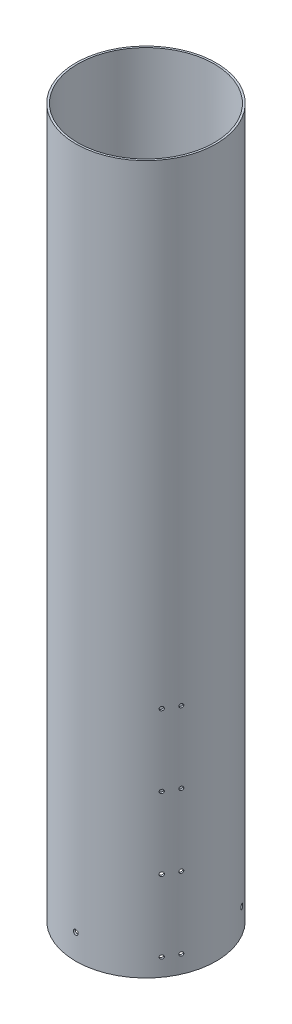
from build123d import *
from OCP.BRepAlgoAPI import BRepAlgoAPI_Cut
from OCP.TopTools import TopTools_ListOfShape

# Parameters (mm, degrees)
SKETCH1_W                          = 78.36
SKETCH1_H                          = 1150
HOLE1_D                            = 152.4
SKETCH4_W                          = 1.62
SKETCH4_H                          = 158.897170611
M3_CLEARANCE_HOLE2_OUTLINE_W       = 1.62
M3_CLEARANCE_HOLE2_OUTLINE_H       = 2.177212512
M3_CLEARANCE_HOLE2_OUTLINE_H_2     = 2.177231722
SKETCH8_W                          = 1.62
SKETCH8_H                          = 158.897170611
F_5_5_5_5_DIAMETER_HOLE1_D         = 5.5
F_5_5_5_5_DIAMETER_HOLE1_DEPTH     = 2.209638872
F_5_5_5_5_DIAMETER_HOLE2_D         = 5.5
F_5_5_5_5_DIAMETER_HOLE2_DEPTH     = 30.891389512
F_5_5_5_5_DIAMETER_HOLE3_D         = 5.5
F_5_5_5_5_DIAMETER_HOLE3_DEPTH     = 30.891389512
HOLE2_REACH                        = 1167.167
HOLE2_BORE_R                       = 2.102512626
F_4_5_4_5_DIAMETER_HOLE1_REACH     = 1167.169
F_4_5_4_5_DIAMETER_HOLE1_BORE_R    = 2.25
HOLE3_REACH                        = 1167.167
HOLE3_BORE_R                       = 2.102512626
F_4_5_4_5_DIAMETER_HOLE2_REACH     = 1167.169
F_4_5_4_5_DIAMETER_HOLE2_BORE_R    = 2.25
HOLE4_REACH                        = 1165.242
HOLE4_BORE_R                       = 2.102512626
F_4_5_START                        = -79
F_4_5_4_5_DIAMETER_HOLE3_OUTLINE_R = 2.25
F_4_5_4_5_DIAMETER_HOLE3_DEPTH     = 4
CUT_EXTRUDE1_START                 = -360
SKETCH28_R                         = 78.36
CUT_EXTRUDE1_DEPTH                 = 360


with BuildPart() as part:
    # Sketch1 → Revolve1 (revolve)
    with BuildSketch(Plane(origin=(0, 0, 0), x_dir=(-1, 0, 0), z_dir=(0, 0, -1)), mode=Mode.PRIVATE) as revolve1_sk:
        with Locations((-39.18, 575)):
            Rectangle(SKETCH1_W, SKETCH1_H)
    revolve(revolve1_sk.sketch.rotate(Axis((0, 0, 0), (0, 1, 0)), 270), axis=Axis((0, 0, 0), (0, 1, 0)))

    # Hole1 (through all)
    with Locations(Plane(origin=(0, 0, 0), x_dir=(-1, 0, 0), z_dir=(0, -1, 0))):
        with Locations((0, 0)):
            Hole(HOLE1_D / 2)

    # Sketch4 → M3 Clearance Hole1 (revolve, cut)
    with BuildSketch(Plane(origin=(-67.861735685, 1140, -39.179991365), x_dir=(-0.5000000000000017, 0, 0.8660254037844377), z_dir=(0, 1, 0))):
        with Locations((0.81, 79.448585306)):
            Rectangle(SKETCH4_W, SKETCH4_H)
    revolve(axis=Axis((-73.360996999, 1140, -42.354991365), (0.8660254037844377, 0, 0.5000000000000017)), mode=Mode.SUBTRACT)


with BuildPart() as m3_clearance_hole2_tool:
    # M3 Clearance Hole2: read off the stored shape, not the designer's step
    # M3 Clearance Hole2 outline → M3 Clearance Hole2 (revolve)
    with BuildSketch(Plane.XZ.offset(-1140)):
        with Locations((0.81, -77.271376475)):
            Rectangle(M3_CLEARANCE_HOLE2_OUTLINE_W, M3_CLEARANCE_HOLE2_OUTLINE_H)
        with Locations((0.81, 77.271384187)):
            Rectangle(M3_CLEARANCE_HOLE2_OUTLINE_W, M3_CLEARANCE_HOLE2_OUTLINE_H_2)
    revolve(axis=Axis((0, 1140, 0), (0, 0, 1)))


with BuildPart() as part_1:
    add(part.part)

    # M3 Clearance Hole2: cut by m3_clearance_hole2_tool, with a tolerance
    m3_clearance_hole2_stock = TopTools_ListOfShape()
    m3_clearance_hole2_stock.Append(part_1.part.wrapped)
    m3_clearance_hole2_tools = TopTools_ListOfShape()
    m3_clearance_hole2_tools.Append(m3_clearance_hole2_tool.part.wrapped)
    m3_clearance_hole2_cut = BRepAlgoAPI_Cut()
    m3_clearance_hole2_cut.SetArguments(m3_clearance_hole2_stock)
    m3_clearance_hole2_cut.SetTools(m3_clearance_hole2_tools)
    m3_clearance_hole2_cut.SetFuzzyValue(0.00001)
    m3_clearance_hole2_cut.Build()
    add(Compound.cast(m3_clearance_hole2_cut.Shape()).solids(), mode=Mode.REPLACE)

    # Sketch8 → M3 Clearance Hole3 (revolve, cut)
    with BuildSketch(Plane(origin=(67.861735685, 1140, -39.179991365), x_dir=(-0.5000000000000004, 0, -0.8660254037844384), z_dir=(0, 1, 0))):
        with Locations((0.81, 79.448585306)):
            Rectangle(SKETCH8_W, SKETCH8_H)
    revolve(axis=Axis((73.360996999, 1140, -42.354991365), (-0.8660254037844384, 0, 0.5000000000000004)), mode=Mode.SUBTRACT)

    # Ø5.5 (5.5) Diameter Hole1
    with Locations(Plane(origin=(0, 0, 76.150361128), x_dir=(-1, 0, 0), z_dir=(0, 0, -1))):
        with Locations((0, 28)):
            Hole(F_5_5_5_5_DIAMETER_HOLE1_D / 2, depth=F_5_5_5_5_DIAMETER_HOLE1_DEPTH)

    # Ø5.5 (5.5) Diameter Hole2
    with Locations(Plane(origin=(-65.948147245, 0, -38.075180564), x_dir=(0.5000000000000006, 0, -0.8660254037844384), z_dir=(0.8660254037844385, 0, 0.5000000000000006))):
        with Locations((0, 28)):
            Hole(F_5_5_5_5_DIAMETER_HOLE2_D / 2, depth=F_5_5_5_5_DIAMETER_HOLE2_DEPTH)

    # Ø5.5 (5.5) Diameter Hole3
    with Locations(Plane(origin=(65.948147245, 0, -38.075180564), x_dir=(0.4999999999999999, 0, 0.8660254037844387), z_dir=(-0.8660254037844387, 0, 0.4999999999999999))):
        with Locations((0, 28)):
            Hole(F_5_5_5_5_DIAMETER_HOLE3_D / 2, depth=F_5_5_5_5_DIAMETER_HOLE3_DEPTH)

    # Hole2 bore → Hole2 (cut, up to next)
    with BuildSketch(Plane(origin=(67.669283519, 0, 39.068879056), x_dir=(0.4999999999999999, 0, -0.8660254037844387), z_dir=(0.8660254037844387, 0, 0.4999999999999999)), mode=Mode.PRIVATE) as hole2_sk1:
        with Locations((-8, 19.673075684)):
            Circle(HOLE2_BORE_R)
    hole2_tool1 = extrude(hole2_sk1.sketch, amount=-HOLE2_REACH, mode=Mode.PRIVATE) & part_1.part
    # Hole2 bore → Hole2 (cut, up to next)
    with BuildSketch(Plane(origin=(67.669283519, 0, 39.068879056), x_dir=(0.4999999999999999, 0, -0.8660254037844387), z_dir=(0.8660254037844387, 0, 0.4999999999999999)), mode=Mode.PRIVATE) as hole2_sk2:
        with Locations((8, 179.673075684)):
            Circle(HOLE2_BORE_R)
    hole2_tool2 = extrude(hole2_sk2.sketch, amount=-HOLE2_REACH, mode=Mode.PRIVATE) & part_1.part
    # Hole2 bore → Hole2 (cut, up to next)
    with BuildSketch(Plane(origin=(67.669283519, 0, 39.068879056), x_dir=(0.4999999999999999, 0, -0.8660254037844387), z_dir=(0.8660254037844387, 0, 0.4999999999999999)), mode=Mode.PRIVATE) as hole2_sk3:
        with Locations((-8, 259.673075684)):
            Circle(HOLE2_BORE_R)
    hole2_tool3 = extrude(hole2_sk3.sketch, amount=-HOLE2_REACH, mode=Mode.PRIVATE) & part_1.part
    # Hole2 bore → Hole2 (cut, up to next)
    with BuildSketch(Plane(origin=(67.669283519, 0, 39.068879056), x_dir=(0.4999999999999999, 0, -0.8660254037844387), z_dir=(0.8660254037844387, 0, 0.4999999999999999)), mode=Mode.PRIVATE) as hole2_sk4:
        with Locations((8, 259.673075684)):
            Circle(HOLE2_BORE_R)
    hole2_tool4 = extrude(hole2_sk4.sketch, amount=-HOLE2_REACH, mode=Mode.PRIVATE) & part_1.part
    # Hole2 bore → Hole2 (cut, up to next)
    with BuildSketch(Plane(origin=(67.669283519, 0, 39.068879056), x_dir=(0.4999999999999999, 0, -0.8660254037844387), z_dir=(0.8660254037844387, 0, 0.4999999999999999)), mode=Mode.PRIVATE) as hole2_sk5:
        with Locations((-8, 179.673075684)):
            Circle(HOLE2_BORE_R)
    hole2_tool5 = extrude(hole2_sk5.sketch, amount=-HOLE2_REACH, mode=Mode.PRIVATE) & part_1.part
    # Hole2 bore → Hole2 (cut, up to next)
    with BuildSketch(Plane(origin=(67.669283519, 0, 39.068879056), x_dir=(0.4999999999999999, 0, -0.8660254037844387), z_dir=(0.8660254037844387, 0, 0.4999999999999999)), mode=Mode.PRIVATE) as hole2_sk6:
        with Locations((8, 99.673075684)):
            Circle(HOLE2_BORE_R)
    hole2_tool6 = extrude(hole2_sk6.sketch, amount=-HOLE2_REACH, mode=Mode.PRIVATE) & part_1.part
    # Hole2 bore → Hole2 (cut, up to next)
    with BuildSketch(Plane(origin=(67.669283519, 0, 39.068879056), x_dir=(0.4999999999999999, 0, -0.8660254037844387), z_dir=(0.8660254037844387, 0, 0.4999999999999999)), mode=Mode.PRIVATE) as hole2_sk7:
        with Locations((8, 19.673075684)):
            Circle(HOLE2_BORE_R)
    hole2_tool7 = extrude(hole2_sk7.sketch, amount=-HOLE2_REACH, mode=Mode.PRIVATE) & part_1.part
    add(hole2_tool1.solids().sort_by_distance((63.669284, 19.673076, 45.997082))[0], mode=Mode.SUBTRACT)
    add(hole2_tool2.solids().sort_by_distance((71.669284, 179.673076, 32.140676))[0], mode=Mode.SUBTRACT)
    add(hole2_tool3.solids().sort_by_distance((63.669284, 259.673076, 45.997082))[0], mode=Mode.SUBTRACT)
    add(hole2_tool4.solids().sort_by_distance((71.669284, 259.673076, 32.140676))[0], mode=Mode.SUBTRACT)
    add(hole2_tool5.solids().sort_by_distance((63.669284, 179.673076, 45.997082))[0], mode=Mode.SUBTRACT)
    add(hole2_tool6.solids().sort_by_distance((71.669284, 99.673076, 32.140676))[0], mode=Mode.SUBTRACT)
    add(hole2_tool7.solids().sort_by_distance((71.669284, 19.673076, 32.140676))[0], mode=Mode.SUBTRACT)

    # Ø4.5 (4.5) Diameter Hole1 bore → Ø4.5 (4.5) Diameter Hole1 (cut, up to next)
    with BuildSketch(Plane(origin=(67.678802627, 0, 39.074374915), x_dir=(0.4999999999999999, 0, -0.8660254037844387), z_dir=(0.8660254037844387, 0, 0.4999999999999999)), mode=Mode.PRIVATE) as f_4_5_4_5_diameter_hole1_sk1:
        with Locations((-8, 99.673075684)):
            Circle(F_4_5_4_5_DIAMETER_HOLE1_BORE_R)
    f_4_5_4_5_diameter_hole1_tool1 = extrude(f_4_5_4_5_diameter_hole1_sk1.sketch, amount=-F_4_5_4_5_DIAMETER_HOLE1_REACH, mode=Mode.PRIVATE) & part_1.part
    add(f_4_5_4_5_diameter_hole1_tool1.solids().sort_by_distance((63.678803, 99.673076, 46.002578))[0], mode=Mode.SUBTRACT)

    # Hole3 bore → Hole3 (cut, up to next)
    with BuildSketch(Plane(origin=(-67.669283519, 0, 39.068879056), x_dir=(0.4999999999999999, 0, 0.8660254037844387), z_dir=(-0.8660254037844387, 0, 0.4999999999999999)), mode=Mode.PRIVATE) as hole3_sk1:
        with Locations((-8, 19.673075684)):
            Circle(HOLE3_BORE_R)
    hole3_tool1 = extrude(hole3_sk1.sketch, amount=-HOLE3_REACH, mode=Mode.PRIVATE) & part_1.part
    # Hole3 bore → Hole3 (cut, up to next)
    with BuildSketch(Plane(origin=(-67.669283519, 0, 39.068879056), x_dir=(0.4999999999999999, 0, 0.8660254037844387), z_dir=(-0.8660254037844387, 0, 0.4999999999999999)), mode=Mode.PRIVATE) as hole3_sk2:
        with Locations((8, 179.673075684)):
            Circle(HOLE3_BORE_R)
    hole3_tool2 = extrude(hole3_sk2.sketch, amount=-HOLE3_REACH, mode=Mode.PRIVATE) & part_1.part
    # Hole3 bore → Hole3 (cut, up to next)
    with BuildSketch(Plane(origin=(-67.669283519, 0, 39.068879056), x_dir=(0.4999999999999999, 0, 0.8660254037844387), z_dir=(-0.8660254037844387, 0, 0.4999999999999999)), mode=Mode.PRIVATE) as hole3_sk3:
        with Locations((-8, 259.673075684)):
            Circle(HOLE3_BORE_R)
    hole3_tool3 = extrude(hole3_sk3.sketch, amount=-HOLE3_REACH, mode=Mode.PRIVATE) & part_1.part
    # Hole3 bore → Hole3 (cut, up to next)
    with BuildSketch(Plane(origin=(-67.669283519, 0, 39.068879056), x_dir=(0.4999999999999999, 0, 0.8660254037844387), z_dir=(-0.8660254037844387, 0, 0.4999999999999999)), mode=Mode.PRIVATE) as hole3_sk4:
        with Locations((8, 259.673075684)):
            Circle(HOLE3_BORE_R)
    hole3_tool4 = extrude(hole3_sk4.sketch, amount=-HOLE3_REACH, mode=Mode.PRIVATE) & part_1.part
    # Hole3 bore → Hole3 (cut, up to next)
    with BuildSketch(Plane(origin=(-67.669283519, 0, 39.068879056), x_dir=(0.4999999999999999, 0, 0.8660254037844387), z_dir=(-0.8660254037844387, 0, 0.4999999999999999)), mode=Mode.PRIVATE) as hole3_sk5:
        with Locations((-8, 179.673075684)):
            Circle(HOLE3_BORE_R)
    hole3_tool5 = extrude(hole3_sk5.sketch, amount=-HOLE3_REACH, mode=Mode.PRIVATE) & part_1.part
    # Hole3 bore → Hole3 (cut, up to next)
    with BuildSketch(Plane(origin=(-67.669283519, 0, 39.068879056), x_dir=(0.4999999999999999, 0, 0.8660254037844387), z_dir=(-0.8660254037844387, 0, 0.4999999999999999)), mode=Mode.PRIVATE) as hole3_sk6:
        with Locations((8, 99.673075684)):
            Circle(HOLE3_BORE_R)
    hole3_tool6 = extrude(hole3_sk6.sketch, amount=-HOLE3_REACH, mode=Mode.PRIVATE) & part_1.part
    # Hole3 bore → Hole3 (cut, up to next)
    with BuildSketch(Plane(origin=(-67.669283519, 0, 39.068879056), x_dir=(0.4999999999999999, 0, 0.8660254037844387), z_dir=(-0.8660254037844387, 0, 0.4999999999999999)), mode=Mode.PRIVATE) as hole3_sk7:
        with Locations((8, 19.673075684)):
            Circle(HOLE3_BORE_R)
    hole3_tool7 = extrude(hole3_sk7.sketch, amount=-HOLE3_REACH, mode=Mode.PRIVATE) & part_1.part
    add(hole3_tool1.solids().sort_by_distance((-71.669284, 19.673076, 32.140676))[0], mode=Mode.SUBTRACT)
    add(hole3_tool2.solids().sort_by_distance((-63.669284, 179.673076, 45.997082))[0], mode=Mode.SUBTRACT)
    add(hole3_tool3.solids().sort_by_distance((-71.669284, 259.673076, 32.140676))[0], mode=Mode.SUBTRACT)
    add(hole3_tool4.solids().sort_by_distance((-63.669284, 259.673076, 45.997082))[0], mode=Mode.SUBTRACT)
    add(hole3_tool5.solids().sort_by_distance((-71.669284, 179.673076, 32.140676))[0], mode=Mode.SUBTRACT)
    add(hole3_tool6.solids().sort_by_distance((-63.669284, 99.673076, 45.997082))[0], mode=Mode.SUBTRACT)
    add(hole3_tool7.solids().sort_by_distance((-63.669284, 19.673076, 45.997082))[0], mode=Mode.SUBTRACT)

    # Ø4.5 (4.5) Diameter Hole2 bore → Ø4.5 (4.5) Diameter Hole2 (cut, up to next)
    with BuildSketch(Plane(origin=(-67.678802627, 0, 39.074374915), x_dir=(0.4999999999999999, 0, 0.8660254037844387), z_dir=(-0.8660254037844387, 0, 0.4999999999999999)), mode=Mode.PRIVATE) as f_4_5_4_5_diameter_hole2_sk1:
        with Locations((-8, 99.673075684)):
            Circle(F_4_5_4_5_DIAMETER_HOLE2_BORE_R)
    f_4_5_4_5_diameter_hole2_tool1 = extrude(f_4_5_4_5_diameter_hole2_sk1.sketch, amount=-F_4_5_4_5_DIAMETER_HOLE2_REACH, mode=Mode.PRIVATE) & part_1.part
    add(f_4_5_4_5_diameter_hole2_tool1.solids().sort_by_distance((-71.678803, 99.673076, 32.146172))[0], mode=Mode.SUBTRACT)

    # Hole4 bore → Hole4 (cut, up to next)
    with BuildSketch(Plane(origin=(0, 0, -78.137758111), x_dir=(-1, 0, 0), z_dir=(0, 0, -1)), mode=Mode.PRIVATE) as hole4_sk1:
        with Locations((-8, 19.673075684)):
            Circle(HOLE4_BORE_R)
    hole4_tool1 = extrude(hole4_sk1.sketch, amount=-HOLE4_REACH, mode=Mode.PRIVATE) & part_1.part
    # Hole4 bore → Hole4 (cut, up to next)
    with BuildSketch(Plane(origin=(0, 0, -78.137758111), x_dir=(-1, 0, 0), z_dir=(0, 0, -1)), mode=Mode.PRIVATE) as hole4_sk2:
        with Locations((8, 179.673075684)):
            Circle(HOLE4_BORE_R)
    hole4_tool2 = extrude(hole4_sk2.sketch, amount=-HOLE4_REACH, mode=Mode.PRIVATE) & part_1.part
    # Hole4 bore → Hole4 (cut, up to next)
    with BuildSketch(Plane(origin=(0, 0, -78.137758111), x_dir=(-1, 0, 0), z_dir=(0, 0, -1)), mode=Mode.PRIVATE) as hole4_sk3:
        with Locations((-8, 259.673075684)):
            Circle(HOLE4_BORE_R)
    hole4_tool3 = extrude(hole4_sk3.sketch, amount=-HOLE4_REACH, mode=Mode.PRIVATE) & part_1.part
    # Hole4 bore → Hole4 (cut, up to next)
    with BuildSketch(Plane(origin=(0, 0, -78.137758111), x_dir=(-1, 0, 0), z_dir=(0, 0, -1)), mode=Mode.PRIVATE) as hole4_sk4:
        with Locations((8, 259.673075684)):
            Circle(HOLE4_BORE_R)
    hole4_tool4 = extrude(hole4_sk4.sketch, amount=-HOLE4_REACH, mode=Mode.PRIVATE) & part_1.part
    # Hole4 bore → Hole4 (cut, up to next)
    with BuildSketch(Plane(origin=(0, 0, -78.137758111), x_dir=(-1, 0, 0), z_dir=(0, 0, -1)), mode=Mode.PRIVATE) as hole4_sk5:
        with Locations((-8, 179.673075684)):
            Circle(HOLE4_BORE_R)
    hole4_tool5 = extrude(hole4_sk5.sketch, amount=-HOLE4_REACH, mode=Mode.PRIVATE) & part_1.part
    # Hole4 bore → Hole4 (cut, up to next)
    with BuildSketch(Plane(origin=(0, 0, -78.137758111), x_dir=(-1, 0, 0), z_dir=(0, 0, -1)), mode=Mode.PRIVATE) as hole4_sk6:
        with Locations((8, 99.673075684)):
            Circle(HOLE4_BORE_R)
    hole4_tool6 = extrude(hole4_sk6.sketch, amount=-HOLE4_REACH, mode=Mode.PRIVATE) & part_1.part
    # Hole4 bore → Hole4 (cut, up to next)
    with BuildSketch(Plane(origin=(0, 0, -78.137758111), x_dir=(-1, 0, 0), z_dir=(0, 0, -1)), mode=Mode.PRIVATE) as hole4_sk7:
        with Locations((8, 19.673075684)):
            Circle(HOLE4_BORE_R)
    hole4_tool7 = extrude(hole4_sk7.sketch, amount=-HOLE4_REACH, mode=Mode.PRIVATE) & part_1.part
    add(hole4_tool1.solids().sort_by_distance((8, 19.673076, -78.137758))[0], mode=Mode.SUBTRACT)
    add(hole4_tool2.solids().sort_by_distance((-8, 179.673076, -78.137758))[0], mode=Mode.SUBTRACT)
    add(hole4_tool3.solids().sort_by_distance((8, 259.673076, -78.137758))[0], mode=Mode.SUBTRACT)
    add(hole4_tool4.solids().sort_by_distance((-8, 259.673076, -78.137758))[0], mode=Mode.SUBTRACT)
    add(hole4_tool5.solids().sort_by_distance((8, 179.673076, -78.137758))[0], mode=Mode.SUBTRACT)
    add(hole4_tool6.solids().sort_by_distance((-8, 99.673076, -78.137758))[0], mode=Mode.SUBTRACT)
    add(hole4_tool7.solids().sort_by_distance((-8, 19.673076, -78.137758))[0], mode=Mode.SUBTRACT)

    # Ø4.5 (4.5) Diameter Hole3: read off the stored shape, not the designer's step
    # Ø4.5 (4.5) Diameter Hole3 outline → Ø4.5 (4.5) Diameter Hole3 (cut)
    with BuildSketch(Plane.XY.offset(F_4_5_START)):
        with Locations((8, 99.673075684)):
            Circle(F_4_5_4_5_DIAMETER_HOLE3_OUTLINE_R)
    extrude(amount=F_4_5_4_5_DIAMETER_HOLE3_DEPTH, mode=Mode.SUBTRACT)

    # Sketch28 → Cut-Extrude1 (cut)
    with BuildSketch(Plane(origin=(0, 1150, 0), x_dir=(1, 0, 0), z_dir=(0, 1, 0)).offset(CUT_EXTRUDE1_START)):
        with Locations(Location((0, 0, 0), (0, 0, 270))):
            Circle(SKETCH28_R)
    extrude(amount=CUT_EXTRUDE1_DEPTH, mode=Mode.SUBTRACT)


solid = part_1.part
